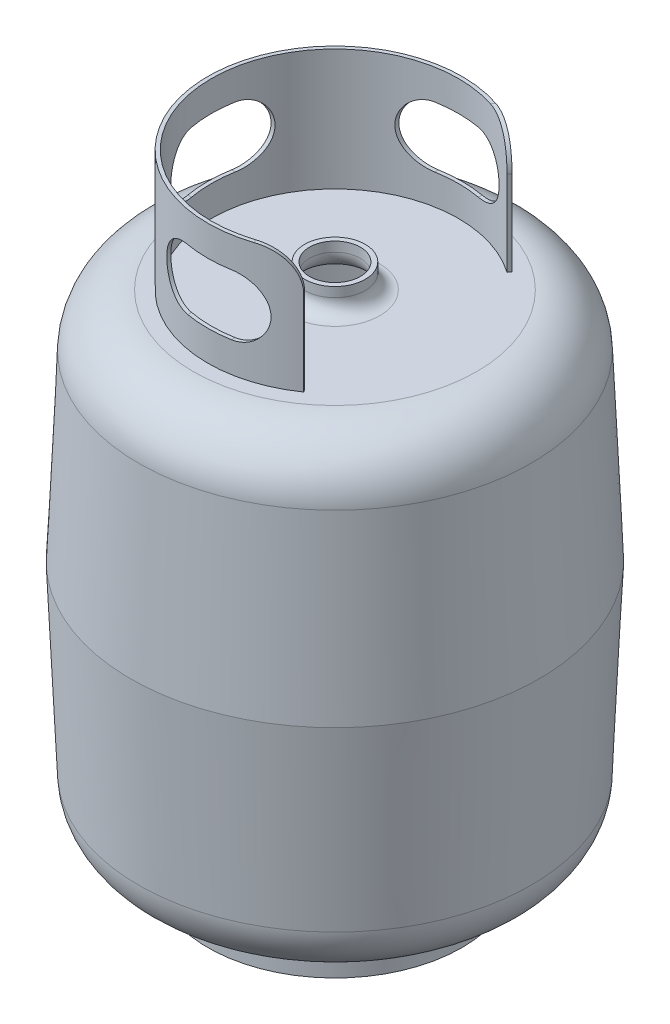
from build123d import *

# Parameters (mm, degrees)
CUT_EXTRUDE1_START  = -30
SKETCH3_R           = 21
CUT_EXTRUDE1_DEPTH  = 30
SKETCH5_R           = 104.921871599
SKETCH5_R_2         = 101.921871599
BOSS_EXTRUDE1_DEPTH = 30
BOSS_EXTRUDE3_START = 100
BOSS_EXTRUDE3_DEPTH = 100
FILLET2_R           = 30
CUT_EXTRUDE2_DEPTH  = 145
CUT_EXTRUDE3_DEPTH  = 145


with BuildPart() as part:
    # Sketch1 → Revolve1 (revolve)
    with BuildSketch(Plane.XY, mode=Mode.PRIVATE) as revolve1_sk:
        with BuildLine():
            Line((0, 0), (116.921871599, 0))
            ThreePointArc((116.921871599, 0), (148.039959109, 12.493621707), (161.87904157, 43.037127569))
            Line((161.87904157, 43.037127569), (168.459307689, 193.75))
            Line((168.459307689, 193.75), (161.87904157, 344.462872431))
            ThreePointArc((161.87904157, 344.462872431), (148.039959109, 375.006378293), (116.921871599, 387.5))
            Line((116.921871599, 387.5), (37, 387.5))
            ThreePointArc((37, 387.5), (28.514718626, 391.014718626), (25, 399.5))
            Line((25, 399.5), (25, 407.5))
            Line((25, 407.5), (0, 407.5))
            Line((0, 407.5), (0, 403.5))
            Line((0, 403.5), (21, 403.5))
            Line((21, 403.5), (21, 399.5))
            ThreePointArc((21, 399.5), (25.686291501, 388.186291501), (37, 383.5))
            Line((37, 383.5), (116.921871599, 383.5))
            ThreePointArc((116.921871599, 383.5), (145.273906886, 372.116922444), (157.882848683, 344.288394882))
            Line((157.882848683, 344.288394882), (164.455496948, 193.75))
            Line((164.455496948, 193.75), (157.882848683, 43.211605118))
            ThreePointArc((157.882848683, 43.211605118), (145.273906886, 15.383077556), (116.921871599, 4))
            Line((116.921871599, 4), (0, 4))
            Line((0, 4), (0, 0))
        make_face()
    revolve(revolve1_sk.sketch.rotate(Axis((0, 579.019102, 0), (0, -1, 0)), 180), axis=Axis((0, 579.019102, 0), (0, -1, 0)))

    # Sketch3 → Cut-Extrude1 (cut)
    with BuildSketch(Plane(origin=(0, 407.5, 0), x_dir=(1, 0, 0), z_dir=(0, 1, 0)).offset(CUT_EXTRUDE1_START)):
        with Locations(Location((0, 0, 0), (0, 0, 180))):
            Circle(SKETCH3_R)
    extrude(amount=CUT_EXTRUDE1_DEPTH, mode=Mode.SUBTRACT)

    # Sketch5 → Boss-Extrude1 (add)
    with BuildSketch(Plane.XZ):
        with Locations(Location((0, 0, 0), (0, 0, 180))):
            Circle(SKETCH5_R)
        Circle(SKETCH5_R_2, mode=Mode.SUBTRACT)
    extrude(amount=BOSS_EXTRUDE1_DEPTH)

    # Sketch6 → Boss-Extrude3 (add)
    with BuildSketch(Plane(origin=(0, 387.5, 0), x_dir=(1, 0, 0), z_dir=(0, 1, 0)).offset(BOSS_EXTRUDE3_START)):
        with BuildLine():
            Line((60.180713207, 85.946965611), (58.459983898, 83.489509478))
            ThreePointArc((58.459983898, 83.489509478), (-101.921871599, 0), (58.459983898, -83.489509478))
            Line((58.459983898, -83.489509478), (60.180713207, -85.946965611))
            ThreePointArc((60.180713207, -85.946965611), (-104.921871599, 0), (60.180713207, 85.946965611))
        make_face()
    extrude(amount=-BOSS_EXTRUDE3_DEPTH)

    # Fillet2
    # the kernel refuses this fillet: 30 mm, written as the material it takes off along each edge
    with BuildSketch(Plane(origin=(15.441751171, 487.5, 22.053106156), x_dir=(0, -1, 0), z_dir=(0.5735764363510621, 0, 0.8191520442889806)), Plane(origin=(103.198945933, 487.5, -147.383368932), x_dir=(0, -1, 0), z_dir=(-0.5735764363510453, 0, 0.8191520442889925))) as fillet2_piece_1:
        with BuildLine():
            CenterArc((FILLET2_R, -FILLET2_R), FILLET2_R, 90, 90)
            Line((0, -FILLET2_R), (0, 0))
            Line((0, 0), (FILLET2_R, 0))
        make_face()
    extrude(amount=153, mode=Mode.SUBTRACT)

    # Sketch7 → Cut-Extrude2 (cut, symmetric)
    with BuildSketch(Plane.XY):
        with BuildLine():
            Line((-18, 462.5), (18, 462.5))
            ThreePointArc((18, 462.5), (43, 437.5), (18, 412.5))
            Line((18, 412.5), (-18, 412.5))
            ThreePointArc((-18, 412.5), (-43, 437.5), (-18, 462.5))
        make_face()
    extrude(amount=CUT_EXTRUDE2_DEPTH, both=True, mode=Mode.SUBTRACT)

    # Sketch8 → Cut-Extrude3 (cut, symmetric)
    with BuildSketch(Plane(origin=(0, 0, 0), x_dir=(0, 0, -1), z_dir=(1, 0, 0))):
        with BuildLine():
            Line((18, 412.5), (-18, 412.5))
            ThreePointArc((-18, 412.5), (-43, 437.5), (-18, 462.5))
            Line((-18, 462.5), (18, 462.5))
            ThreePointArc((18, 462.5), (43, 437.5), (18, 412.5))
        make_face()
    extrude(amount=CUT_EXTRUDE3_DEPTH, both=True, mode=Mode.SUBTRACT)


solid = part.part
